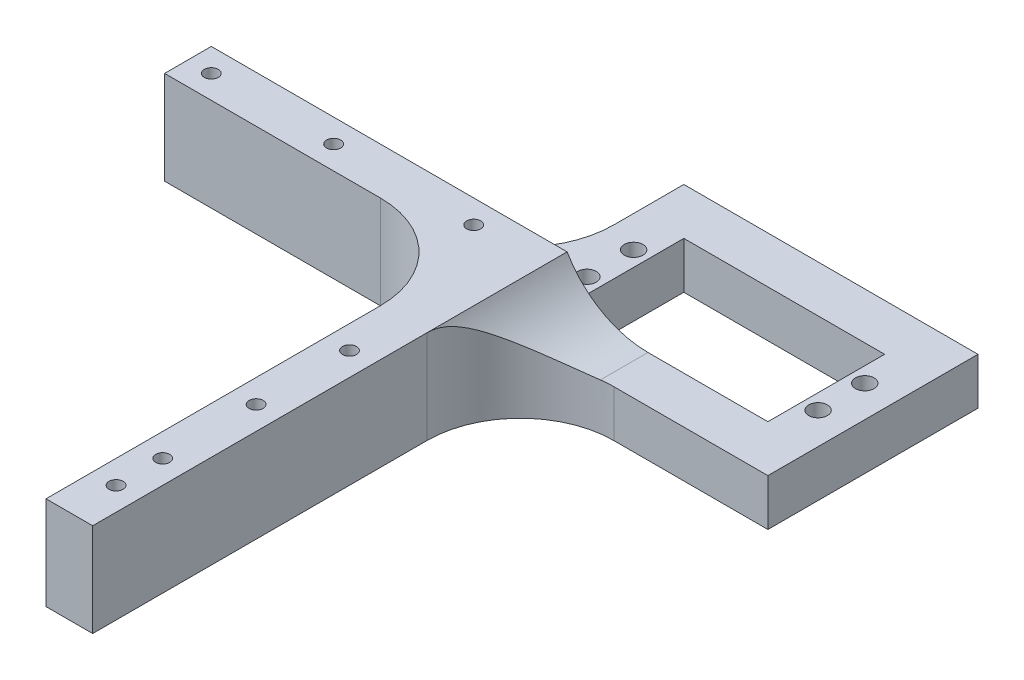
from build123d import *

# Parameters (mm, degrees)
SKETCH1_W               = 63
SKETCH1_H               = 45
SKETCH1_R               = 2
SKETCH1_W_2             = 43
SKETCH1_H_2             = 25
BOSS_EXTRUDE1_DEPTH     = 10
SKETCH2_W               = 10
SKETCH2_H               = 20
BOSS_EXTRUDE2_DEPTH     = 76.2
SKETCH3_W               = 10
SKETCH3_H               = 10
BOSS_EXTRUDE3_DEPTH     = 91.6
SKETCH5_W               = 10
SKETCH5_H               = 101.6
BOSS_EXTRUDE4_DEPTH     = 10
CUT_EXTRUDE1_DEPTH      = 158.219909681
CUT_EXTRUDE1_DEPTH_BACK = 158.219909681
SKETCH4_R               = 1.5
FILLET5_R               = 20
FILLET7_R               = 20
FILLET8_R               = 3
FILLET9_START           = 22.5
FILLET9_DEPTH           = 20.0000001
FILLET9_START_2         = 10
FILLET9_2_DEPTH         = 11
FILLET9_3_DEPTH         = 10
SKETCH6_W               = 10
SKETCH6_H               = 20
CUT_EXTRUDE2_DEPTH      = 10
SKETCH7_R               = 1.5
CUT_EXTRUDE3_DEPTH      = 152.539104801


with BuildPart() as part:
    # Sketch1 → Boss-Extrude1 (new body)
    with BuildSketch(Plane(origin=(0, 0, 0), x_dir=(1, 0, 0), z_dir=(0, 1, 0))):
        Rectangle(SKETCH1_W, SKETCH1_H)
        with Locations(Location((-24.75, 5, 0), (0, 0, 270))):
            Circle(SKETCH1_R, mode=Mode.SUBTRACT)
        with Locations(Location((-24.75, -5, 0), (0, 0, 270))):
            Circle(SKETCH1_R, mode=Mode.SUBTRACT)
        with Locations(Location((24.75, 5, 0), (0, 0, 270))):
            Circle(SKETCH1_R, mode=Mode.SUBTRACT)
        with Locations(Location((24.75, -5, 0), (0, 0, 270))):
            Circle(SKETCH1_R, mode=Mode.SUBTRACT)
        Rectangle(SKETCH1_W_2, SKETCH1_H_2, mode=Mode.SUBTRACT)
    extrude(amount=BOSS_EXTRUDE1_DEPTH)

    # Sketch2 → Boss-Extrude2 (add)
    with BuildSketch(Plane.ZY.offset(31.5)):
        with Locations((17.5, 10)):
            Rectangle(SKETCH2_W, SKETCH2_H)
    extrude(amount=BOSS_EXTRUDE2_DEPTH)

    # Sketch3 → Boss-Extrude3 (add)
    with BuildSketch(Plane.XY.offset(22.5)):
        with Locations((-26.5, 5)):
            Rectangle(SKETCH3_W, SKETCH3_H)
    extrude(amount=BOSS_EXTRUDE3_DEPTH)

    # Sketch5 → Boss-Extrude4 (add)
    with BuildSketch(Plane(origin=(0, 10, 0), x_dir=(1, 0, 0), z_dir=(0, 1, 0))):
        with Locations((-26.5, -63.3)):
            Rectangle(SKETCH5_W, SKETCH5_H)
    extrude(amount=BOSS_EXTRUDE4_DEPTH)

    # Sketch4 → Cut-Extrude1 (cut, two sides: drawn at the far end of the back side and taken through both)
    with BuildSketch(Plane(origin=(0, 10, 0), x_dir=(1, 0, 0), z_dir=(0, 1, 0)).offset(-CUT_EXTRUDE1_DEPTH_BACK)):
        with BuildLine():
            ThreePointArc((-91.2, -17.5), (-92.7, -16), (-94.2, -17.5))
            Line((-94.2, -17.5), (-91.2, -17.5))
        make_face()
        with BuildLine():
            Line((-91.2, -17.5), (-94.2, -17.5))
            ThreePointArc((-94.2, -17.5), (-92.7, -19), (-91.2, -17.5))
        make_face()
        with Locations(Location((-66.5, -17.5, 0), (0, 0, 270))):
            Circle(SKETCH4_R)
        with Locations(Location((-36.5, -17.5, 0), (0, 0, 270))):
            Circle(SKETCH4_R)
    extrude(amount=CUT_EXTRUDE1_DEPTH + CUT_EXTRUDE1_DEPTH_BACK, mode=Mode.SUBTRACT)

    # Fillet5
    fillet5_edges = [part.edges().sort_by_distance(p)[0] for p in [
        (-31.5, 5, 12.5),
        (-31.5, 10, 22.5),
    ]]
    fillet(fillet5_edges, radius=FILLET5_R)

    # Fillet7
    # the kernel refuses this fillet: 20 mm, written as the material it adds along each edge
    with BuildSketch(Plane(origin=(-21.5, 10, 12.5), x_dir=(1, 0, 0), z_dir=(0, 0, 1))) as fillet7_piece_1:
        with BuildLine():
            CenterArc((17.320508076, 20), FILLET7_R, 210, 60)
            Line((0, 10), (-0.346410162, 9.8))
            ThreePointArc((-0.346410162, 9.8), (-0.4, 5), (-0.4, 0))
            Line((-0.4, 0), (0, -0.4))
            Line((0, -0.4), (17.320508076, -0.4))
            Line((17.320508076, -0.4), (17.320508076, 0))
        make_face()
    extrude(amount=10)

    # Fillet8
    fillet8_edges = [part.edges().sort_by_distance(p)[0] for p in [
        (-36.5, 10, 12.5),
    ]]
    fillet(fillet8_edges, radius=FILLET8_R)

    # Fillet9: read off the stored shape, not the designer's step
    # Fillet9 outline → Fillet9 (add)
    with BuildSketch(Plane.XY.offset(FILLET9_START)):
        with BuildLine():
            Line((-21.5, 10), (-4.179491924, 10))
            ThreePointArc((-4.179491924, 10), (-14.179495423, 12.679493944), (-21.50000404, 20.000006998))
            Line((-21.50000404, 20.000006998), (-21.5, 10))
        make_face()
    extrude(amount=FILLET9_DEPTH)

    # Fillet9 2 outline → Fillet9 2 (cut)
    with BuildSketch(Plane(origin=(0, 0, 0), x_dir=(1, 0, 0), z_dir=(0, 1, 0)).offset(FILLET9_START_2)):
        with BuildLine():
            ThreePointArc((-1.5, -22.5), (-15.642135624, -28.357864376), (-21.5, -42.5))
            Line((-21.5, -42.5), (0, -42.5000001))
            Line((0, -42.5000001), (0, -22.5))
            Line((0, -22.5), (-1.5, -22.5))
        make_face()
    extrude(amount=FILLET9_2_DEPTH, mode=Mode.SUBTRACT)

    # Fillet9 3 outline → Fillet9 3 (add)
    with BuildSketch(Plane(origin=(0, 0, 0), x_dir=(1, 0, 0), z_dir=(0, 1, 0))):
        with BuildLine():
            Line((-21.5, -22.5), (-21.5, -42.5))
            ThreePointArc((-21.5, -42.5), (-15.642135624, -28.357864376), (-1.5, -22.5))
            Line((-1.5, -22.5), (-21.5, -22.5))
        make_face()
    extrude(amount=FILLET9_3_DEPTH)

    # Sketch6 → Cut-Extrude2 (cut)
    with BuildSketch(Plane.ZY.offset(107.7)):
        with Locations((17.5, 10)):
            Rectangle(SKETCH6_W, SKETCH6_H)
    extrude(amount=-CUT_EXTRUDE2_DEPTH, mode=Mode.SUBTRACT)

    # Sketch7 → Cut-Extrude3 (cut, through all)
    with BuildSketch(Plane(origin=(0, 0, 0), x_dir=(-1, 0, 0), z_dir=(0, -1, 0))):
        with Locations(Location((26.5, -54.1, 0), (0, 0, 90))):
            Circle(SKETCH7_R)
        with Locations(Location((26.5, -94.1, 0), (0, 0, 90))):
            Circle(SKETCH7_R)
        with Locations(Location((26.5, -74.1, 0), (0, 0, 90))):
            Circle(SKETCH7_R)
        with Locations(Location((26.5, -104.1, 0), (0, 0, 90))):
            Circle(SKETCH7_R)
    extrude(amount=-CUT_EXTRUDE3_DEPTH, mode=Mode.SUBTRACT)


solid = part.part
